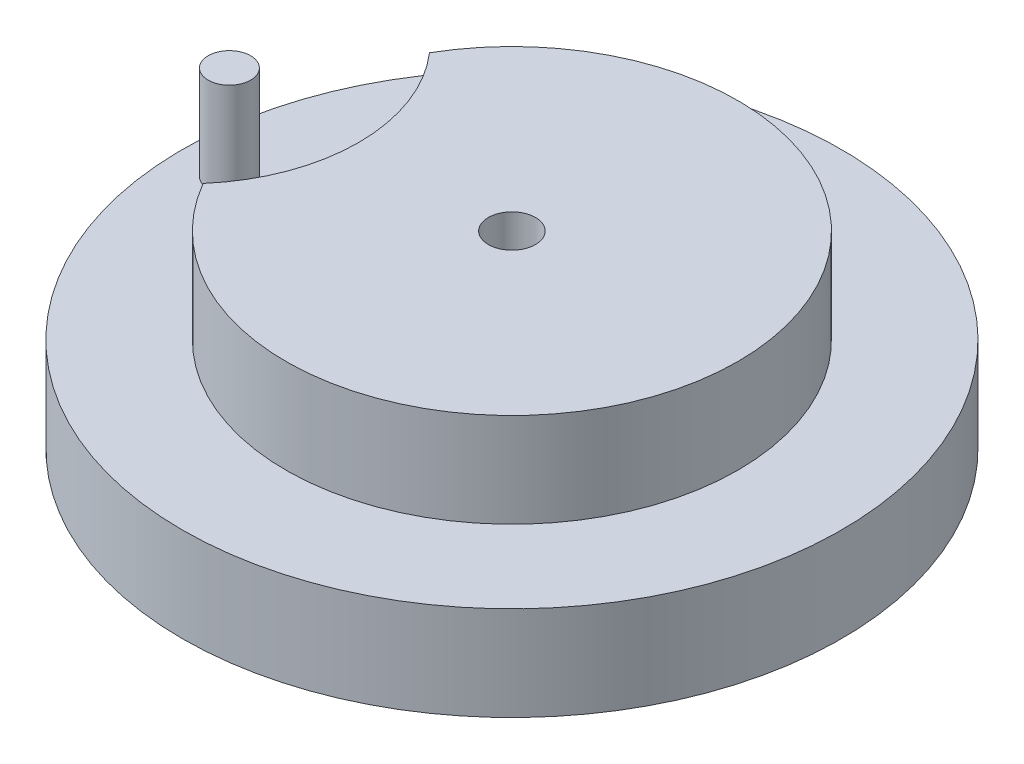
from build123d import *

# Parameters (mm, degrees)
SKETCH_2_R      = 35
SKETCH_2_R_2    = 2.5
EXTRUDE_1_DEPTH = 10
SKETCH_3_R      = 2.25
SKETCH_3_R_2    = 2.5
EXTRUDE_2_DEPTH = 10


with BuildPart() as part:
    # 草圖2 → 填料-伸長1 (new body)
    with BuildSketch(Plane(origin=(0, 0, 0), x_dir=(1, 0, 0), z_dir=(0, 1, 0))):
        Circle(SKETCH_2_R)
        Circle(SKETCH_2_R_2, mode=Mode.SUBTRACT)
    extrude(amount=EXTRUDE_1_DEPTH)

    # 草圖3 → 填料-伸長2 (add)
    # profile 1 of 2: a face of its own
    with BuildSketch(Plane(origin=(0, 10, 0), x_dir=(1, 0, 0), z_dir=(0, 1, 0))):
        with Locations((-30, 0)):
            Circle(SKETCH_3_R)
    # profile 2 of 2: a face of its own
    with BuildSketch(Plane(origin=(0, 10, 0), x_dir=(1, 0, 0), z_dir=(0, 1, 0))):
        with BuildLine():
            ThreePointArc((-20.773318517, -12.019535673), (24, 0), (-20.773318517, 12.019535673))
            ThreePointArc((-20.773318517, 12.019535673), (-16.277495404, 0), (-20.773318517, -12.019535673))
        make_face()
        Circle(SKETCH_3_R_2, mode=Mode.SUBTRACT)
    extrude(amount=EXTRUDE_2_DEPTH)


solid = part.part
